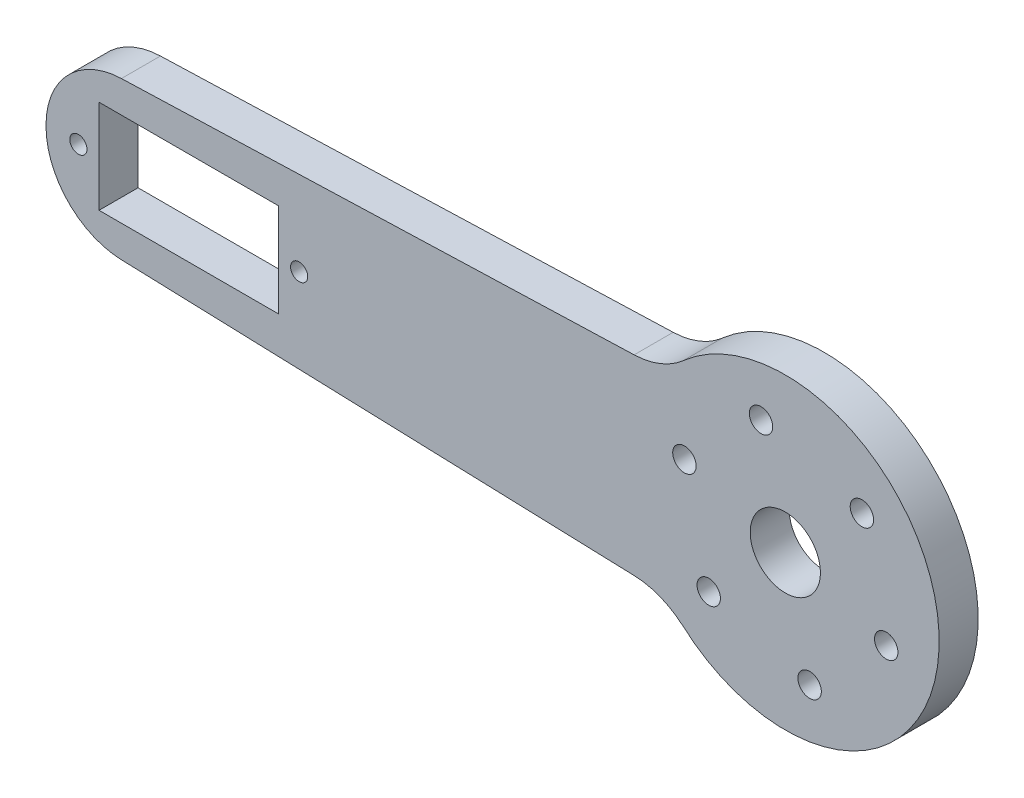
from build123d import *

# Parameters (mm, degrees)
SKETCH1_R           = 1.960784314
SKETCH1_W           = 23
SKETCH1_H           = 12
BOSS_EXTRUDE1_DEPTH = 5
FILLET2_R           = 20
SKETCH3_R           = 19.722379498
SKETCH3_R_2         = 3
BOSS_EXTRUDE2_DEPTH = 5
FILLET3_R           = 10
SKETCH6_R           = 4.5
CUT_EXTRUDE3_DEPTH  = 6
SKETCH7_R           = 1.5
SKETCH7_R_2         = 4.5
CUT_EXTRUDE4_DEPTH  = 10
SKETCH9_R           = 1.1
CUT_EXTRUDE6_DEPTH  = 10


with BuildPart() as part:
    # Sketch1 → Boss-Extrude1 (new body)
    with BuildSketch(Plane.XY):
        Polygon((49.019607843, 13.071895425), (49.019607843, -13.071895425), (-49.019607843, -9.803921569), (-50.980392157, -9.803921569), (-50.980392157, 9.803921569), (-49.019607843, 9.803921569), align=None)
        with Locations((43.790849673, 0)):
            Circle(SKETCH1_R, mode=Mode.SUBTRACT)
        with Locations((-32.679738562, 0)):
            Rectangle(SKETCH1_W, SKETCH1_H, mode=Mode.SUBTRACT)
    extrude(amount=BOSS_EXTRUDE1_DEPTH)

    # Fillet2
    # the kernel refuses this fillet: 20 mm, written as the material it takes off along each edge
    with BuildSketch(Plane(origin=(49.019607843, -13.071895425, -51.694436733), x_dir=(0, 1, 0), z_dir=(0, 0, 1))) as fillet2_piece_1:
        with BuildLine():
            CenterArc((FILLET2_R * 1.03388873465, FILLET2_R), FILLET2_R, 178.090847567, 91.909152433)
            Line((FILLET2_R * 0.0344438276744, FILLET2_R * 1.03331483023), (0, 0))
            Line((0, 0), (FILLET2_R * 1.03388873465, 0))
        make_face()
    extrude(amount=108.388873465, mode=Mode.SUBTRACT)
    with BuildSketch(Plane(origin=(49.019607843, 13.071895425, -51.694436733), x_dir=(0, -1, 0), z_dir=(0, 0, 1))) as fillet2_piece_2:
        with BuildLine():
            CenterArc((FILLET2_R * 1.03388873465, -FILLET2_R), FILLET2_R, 90, 91.909152433)
            Line((FILLET2_R * 0.0344438276744, -FILLET2_R * 1.03331483023), (0, 0))
            Line((0, 0), (FILLET2_R * 1.03388873465, 0))
        make_face()
    extrude(amount=108.388873465, mode=Mode.SUBTRACT)

    # Sketch3 → Boss-Extrude2 (add)
    with BuildSketch(Plane.XY.offset(5)):
        with Locations((43.790849673, 0)):
            Circle(SKETCH3_R)
        with Locations((43.790849673, 0)):
            Circle(SKETCH3_R_2, mode=Mode.SUBTRACT)
    extrude(amount=-BOSS_EXTRUDE2_DEPTH)

    # Fillet3
    fillet3_edges = [part.edges().sort_by_distance(p)[0] for p in [
        (-50.980392157, 9.803921569, 2.5),
        (-50.980392157, -9.803921569, 2.5),
        (28.442748303, -12.385799828, 2.5),
        (28.442748303, 12.385799828, 2.5),
    ]]
    fillet(fillet3_edges, radius=FILLET3_R)

    # Sketch6 → Cut-Extrude3 (cut)
    with BuildSketch(Plane.XY.offset(5)):
        with Locations((43.790849673, 0)):
            Circle(SKETCH6_R)
    extrude(amount=-CUT_EXTRUDE3_DEPTH, mode=Mode.SUBTRACT)

    # Sketch7 → Cut-Extrude4 (cut)
    with BuildSketch(Plane.XY.offset(5)):
        with Locations((53.608271623, 9.266511008)):
            Circle(SKETCH7_R)
        with Locations((43.790849673, 0)):
            Circle(SKETCH7_R_2)
        with Locations((56.724594586, -3.868881304)):
            Circle(SKETCH7_R)
        with Locations((46.907172636, -13.135392312)):
            Circle(SKETCH7_R)
        with Locations((33.973427724, -9.266511008)):
            Circle(SKETCH7_R)
        with Locations((30.857104761, 3.868881304)):
            Circle(SKETCH7_R)
        with Locations((40.67452671, 13.135392312)):
            Circle(SKETCH7_R)
    extrude(amount=-CUT_EXTRUDE4_DEPTH, mode=Mode.SUBTRACT)

    # Sketch9 → Cut-Extrude6 (cut)
    with BuildSketch(Plane.XY.offset(5)):
        with Locations((-46.829738562, 0)):
            Circle(SKETCH9_R)
        with Locations((-18.529738562, 0)):
            Circle(SKETCH9_R)
    extrude(amount=-CUT_EXTRUDE6_DEPTH, mode=Mode.SUBTRACT)


solid = part.part
